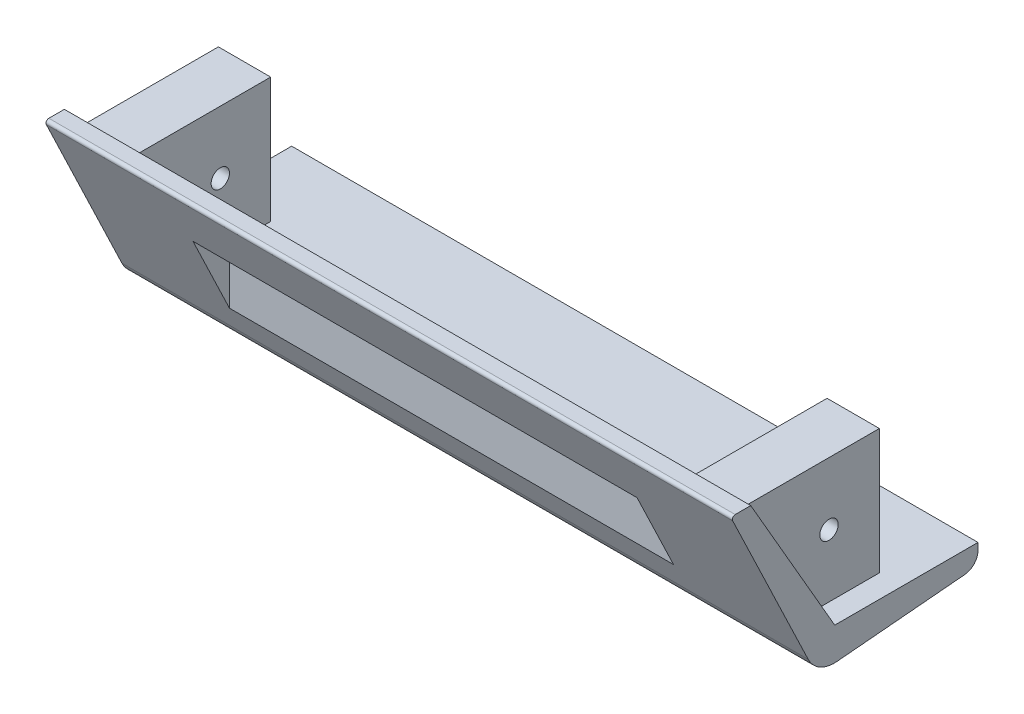
from build123d import *

# Parameters (mm, degrees)
BOSS_EXTRUDE2_DEPTH             = 119.775
BOSS_EXTRUDE1_REACH             = 141.38
SKETCH2_W                       = 18.25
SKETCH2_H                       = 43.65
BOSS_EXTRUDE1_DIRECTION_2_DEPTH = 20
CUT_EXTRUDE2_DEPTH              = 77.5
FILLET1_R                       = 10
FILLET2_R                       = 5
FILLET3_R                       = 1
CUT_EXTRUDE3_DEPTH              = 10
M6_CLEARANCE_HOLE1_D            = 6.4


with BuildPart() as part:
    # Sketch1 → Boss-Extrude2 (new, symmetric)
    with BuildSketch(Plane(origin=(0, 0, 0), x_dir=(0, 0, -1), z_dir=(1, 0, 0))):
        Polygon((0, 0), (-29.329393675, 50.8), (-36.329393675, 50.8), (-6.252899132, -12), (50, -7), (50, 0), align=None)
    extrude(amount=BOSS_EXTRUDE2_DEPTH, both=True)

    # Boss-Extrude1: up to this plane
    boss_extrude1_end = Plane(origin=(119.775, 0, 0), z_dir=(0, -0.5000000000000043, 0.8660254037844362))
    # Sketch2 → Boss-Extrude1 (add, up to the surface)
    with BuildSketch(Plane.XY, mode=Mode.PRIVATE) as boss_extrude1_sk1:
        with Locations((106.225, 25.4)):
            Rectangle(SKETCH2_W, SKETCH2_H)
    boss_extrude1_tool1 = split(extrude(boss_extrude1_sk1.sketch, amount=BOSS_EXTRUDE1_REACH, mode=Mode.PRIVATE), bisect_by=boss_extrude1_end, keep=Keep.BOTH, mode=Mode.PRIVATE)
    add(boss_extrude1_tool1.solids().sort_by_distance((106.225, 25.4, 0))[0])
    # Sketch2 → Boss-Extrude1 (add, up to the surface)
    with BuildSketch(Plane.XY, mode=Mode.PRIVATE) as boss_extrude1_sk2:
        with Locations((-106.225, 25.4)):
            Rectangle(SKETCH2_W, SKETCH2_H)
    boss_extrude1_tool2 = split(extrude(boss_extrude1_sk2.sketch, amount=BOSS_EXTRUDE1_REACH, mode=Mode.PRIVATE), bisect_by=boss_extrude1_end, keep=Keep.BOTH, mode=Mode.PRIVATE)
    add(boss_extrude1_tool2.solids().sort_by_distance((-106.225, 25.4, 0))[0])

    # Sketch2 → Boss-Extrude1 direction 2 (add)
    with BuildSketch(Plane.XY):
        with Locations((106.225, 25.4)):
            Rectangle(SKETCH2_W, SKETCH2_H)
        with Locations((-106.225, 25.4)):
            Rectangle(SKETCH2_W, SKETCH2_H)
    extrude(amount=-BOSS_EXTRUDE1_DIRECTION_2_DEPTH)

    # Sketch4 → Cut-Extrude2 (cut, symmetric)
    with BuildSketch(Plane(origin=(0, 0, 0), x_dir=(0, 0, -1), z_dir=(1, 0, 0))):
        Polygon((-26.729651832, 30.755649855), (-20, 34.641016151), (-14, 24.248711306), (-14, 4.176018579), align=None)
    extrude(amount=CUT_EXTRUDE2_DEPTH, both=True, mode=Mode.SUBTRACT)

    # Fillet1
    fillet1_edges = [part.edges().sort_by_distance(p)[0] for p in [
        (0, -12, 6.252899132),
    ]]
    fillet(fillet1_edges, radius=FILLET1_R)

    # Fillet2
    fillet2_edges = [part.edges().sort_by_distance(p)[0] for p in [
        (0, -7, -50),
    ]]
    fillet(fillet2_edges, radius=FILLET2_R)

    # Fillet3
    fillet3_edges = [part.edges().sort_by_distance(p)[0] for p in [
        (0, 50.8, 36.329393675),
    ]]
    fillet(fillet3_edges, radius=FILLET3_R)

    # Sketch8 → Cut-Extrude3 (cut)
    with BuildSketch(Plane.ZY.offset(-77.5)):
        with BuildLine():
            Line((20, 34.641016151), (22.598076211, 33.141016151))
            Line((22.598076211, 33.141016151), (17.598076211, 24.480762114))
            ThreePointArc((17.598076211, 24.480762114), (16.383663494, 23.548910461), (14.866025404, 23.748711306))
            Line((14.866025404, 23.748711306), (14, 24.248711306))
            Line((14, 24.248711306), (20, 34.641016151))
        make_face()
    extrude(amount=-CUT_EXTRUDE3_DEPTH, mode=Mode.SUBTRACT)

    # M6 Clearance Hole1 (through all)
    with Locations(Plane(origin=(115.35, 0, 0), x_dir=(0, 0, -1), z_dir=(1, 0, 0))):
        with Locations((2.420606325, 25.4)):
            Hole(M6_CLEARANCE_HOLE1_D / 2)


solid = part.part
